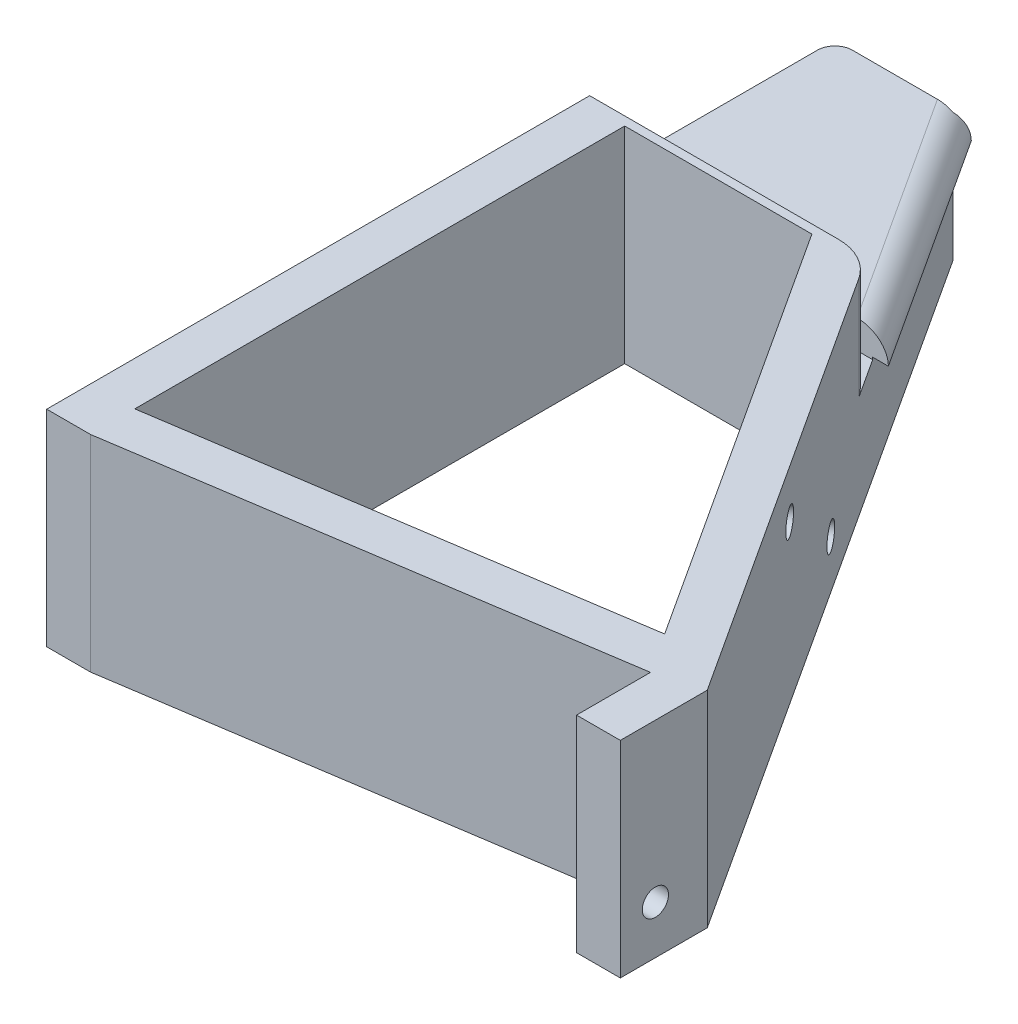
from build123d import *

# Parameters (mm, degrees)
BOSS_EXTRU_1_DEPTH       = 23.5
ESQUISSE10_W             = 28
ESQUISSE10_H             = 8.5
ENL_V_MAT_EXTRU_9_DEPTH  = 114.765108887
ESQUISSE11_W             = 33.386172199
ESQUISSE11_H             = 3
BOSS_EXTRU_2_DEPTH       = 1.5
ESQUISSE12_W             = 1.8
ESQUISSE12_H             = 11.75
ENL_V_MAT_EXTRU_10_DEPTH = 114.765108887
COQUE2_DEPTH             = 23.5
COQUE2_2_DEPTH           = 10.75
COQUE2_START             = 10.75
COQUE2_3_DEPTH           = 3.25
CONG_2_R                 = 2
CONG_3_R                 = 3
ESQUISSE5_R              = 1.5
ENL_V_MAT_EXTRU_4_DEPTH  = 8
ESQUISSE7_R              = 1.5
ENL_V_MAT_EXTRU_6_DEPTH  = 8
ESQUISSE9_R              = 1.5
ENL_V_MAT_EXTRU_8_DEPTH  = 7.5
BOSS_EXTRU_3_DEPTH       = 23.5
BOSS_EXTRU_4_DEPTH       = 10.75
ENL_V_MAT_EXTRU_11_DEPTH = 2.5
ENL_V_MAT_EXTRU_12_DEPTH = 2.5
ENL_V_MAT_EXTRU_13_DEPTH = 2.5
CONG_5_R                 = 6


# Read off the part's stored shape, not the designer's step: Coque2
with BuildPart() as part:
    # Esquisse1 → Boss.-Extru.1 (new body)
    with BuildSketch(Plane(origin=(0, 0, 0), x_dir=(1, 0, 0), z_dir=(0, 1, 0))):
        Polygon((0, 0), (13.5, 0), (65.5, -80.072978118), (65.5, -90), (0, -90), align=None)
    extrude(amount=BOSS_EXTRU_1_DEPTH)

    # Esquisse10 → Enlèv. mat.-Extru.9 (cut, through all)
    with BuildSketch(Plane(origin=(65.5, 0, 0), x_dir=(0, 0, -1), z_dir=(1, 0, 0))):
        with Locations((-14, 19.25)):
            Rectangle(ESQUISSE10_W, ESQUISSE10_H)
    extrude(amount=-ENL_V_MAT_EXTRU_9_DEPTH, mode=Mode.SUBTRACT)

    # Esquisse11 → Boss.-Extru.2 (add)
    with BuildSketch(Plane(origin=(9.495472341, 0, -6.166431839), x_dir=(-0.5446390350150256, 0, -0.838670567945425), z_dir=(0.8386705679454252, 0, -0.5446390350150256))):
        with Locations((-24.045713072, 13.5)):
            Rectangle(ESQUISSE11_W, ESQUISSE11_H)
    extrude(amount=BOSS_EXTRU_2_DEPTH)

    # Esquisse12 → Enlèv. mat.-Extru.10 (cut, through all)
    with BuildSketch(Plane.ZY):
        with Locations((27.1, 17.625)):
            Rectangle(ESQUISSE12_W, ESQUISSE12_H)
    extrude(amount=-ENL_V_MAT_EXTRU_10_DEPTH, mode=Mode.SUBTRACT)

    # Coque2 outline → Coque2 (cut)
    with BuildSketch(Plane(origin=(0, 0, 0), x_dir=(1, 0, 0), z_dir=(0, 1, 0))):
        Polygon((60.5, -81.554045593), (26.371003739, -29), (5, -29), (5, -90), (60.5, -90), align=None)
    extrude(amount=COQUE2_DEPTH, mode=Mode.SUBTRACT)

    # Coque2 2 outline → Coque2 2 (cut)
    with BuildSketch(Plane(origin=(0, 0, 0), x_dir=(1, 0, 0), z_dir=(0, 1, 0))):
        Polygon((10.785221502, -5), (5, -5), (5, -29), (26.371003739, -29), align=None)
    extrude(amount=COQUE2_2_DEPTH, mode=Mode.SUBTRACT)

    # Coque2 3 outline → Coque2 3 (cut)
    with BuildSketch(Plane(origin=(0, 0, 0), x_dir=(1, 0, 0), z_dir=(0, 1, 0)).offset(COQUE2_START)):
        Polygon((23.903254884, -25.2), (10.785221502, -5), (5, -5), (5, -25.2), align=None)
    extrude(amount=COQUE2_3_DEPTH, mode=Mode.SUBTRACT)

    # Congé2
    cong_2_edges = [part.edges().sort_by_distance(p)[0] for p in [
        (0, 7.5, 0),
    ]]
    fillet(cong_2_edges, radius=CONG_2_R)

    # Congé3
    cong_3_edges = [part.edges().sort_by_distance(p)[0] for p in [
        (23.530514866, 15, 12.691520724),
    ]]
    fillet(cong_3_edges, radius=CONG_3_R - 0.0001)  # a hair under: the kernel refuses the full size

    # Esquisse5 → Enlèv. mat.-Extru.4 (cut)
    with BuildSketch(Plane.ZY):
        with Locations((15, 7)):
            Circle(ESQUISSE5_R)
        with Locations((75, 7)):
            Circle(ESQUISSE5_R)
    extrude(amount=-ENL_V_MAT_EXTRU_4_DEPTH, mode=Mode.SUBTRACT)

    # Esquisse7 → Enlèv. mat.-Extru.6 (cut)
    with BuildSketch(Plane(origin=(9.495472341, 0, -6.166431839), x_dir=(-0.5446390350150254, 0, -0.8386705679454252), z_dir=(0.8386705679454252, 0, -0.5446390350150254))):
        with Locations((-54.852626973, 5.5)):
            Circle(ESQUISSE7_R)
        with Locations(Location((-70.828706829, 18, 0), (0, 0, 180))):
            Circle(ESQUISSE7_R)
    extrude(amount=-ENL_V_MAT_EXTRU_6_DEPTH, mode=Mode.SUBTRACT)

    # Esquisse9 → Enlèv. mat.-Extru.8 (cut)
    with BuildSketch(Plane(origin=(65.5, 0, 0), x_dir=(0, 0, -1), z_dir=(1, 0, 0))):
        with Locations((-86, 5.5)):
            Circle(ESQUISSE9_R)
    extrude(amount=-ENL_V_MAT_EXTRU_8_DEPTH, mode=Mode.SUBTRACT)

    # Esquisse13 → Boss.-Extru.3 (add)
    with BuildSketch(Plane.XZ):
        Polygon((60.5, 81.554045593), (5, 90), (5, 84.94243498), (57.510973677, 76.951348682), align=None)
    extrude(amount=-BOSS_EXTRU_3_DEPTH)

    # Esquisse14 → Boss.-Extru.4 (add)
    with BuildSketch(Plane.XZ.offset(-10.75)):
        Polygon((5, 25.2), (23.903254884, 25.2), (26.371003739, 29), (5, 29), align=None)
    extrude(amount=BOSS_EXTRU_4_DEPTH)

    # Esquisse16 → Enlèv. mat.-Extru.11 (cut)
    with BuildSketch(Plane(origin=(5, 0, 0), x_dir=(0, 0, -1), z_dir=(1, 0, 0))):
        Polygon((-72.25, 8.58771324), (-75, 10.175426481), (-77.75, 8.58771324), (-77.75, 5.41228676), (-75, 3.824573519), (-72.25, 5.41228676), align=None)
        Polygon((-12.25, 8.58771324), (-15, 10.175426481), (-17.75, 8.58771324), (-17.75, 5.41228676), (-15, 3.824573519), (-12.25, 5.41228676), align=None)
    extrude(amount=-ENL_V_MAT_EXTRU_11_DEPTH, mode=Mode.SUBTRACT)

    # Esquisse17 → Enlèv. mat.-Extru.12 (cut)
    with BuildSketch(Plane.ZY.offset(-60.5)):
        Polygon((86, 2.324573519), (88.75, 3.91228676), (88.75, 7.08771324), (86, 8.675426481), (83.25, 7.08771324), (83.25, 3.91228676), align=None)
    extrude(amount=-ENL_V_MAT_EXTRU_12_DEPTH, mode=Mode.SUBTRACT)

    # Esquisse18 → Enlèv. mat.-Extru.13 (cut)
    with BuildSketch(Plane(origin=(5.302119501, 0, -3.443236664), x_dir=(0.5446390350150256, 0, 0.838670567945425), z_dir=(-0.8386705679454252, 0, 0.5446390350150256))):
        Polygon((57.602626973, 7.08771324), (54.852626973, 8.675426481), (52.102626973, 7.08771324), (52.102626973, 3.91228676), (54.852626973, 2.324573519), (57.602626973, 3.91228676), align=None)
        Polygon((73.578706829, 19.58771324), (70.828706829, 21.175426481), (68.078706829, 19.58771324), (68.078706829, 16.41228676), (70.828706829, 14.824573519), (73.578706829, 16.41228676), align=None)
    extrude(amount=-ENL_V_MAT_EXTRU_13_DEPTH, mode=Mode.SUBTRACT)

    # Congé5
    cong_5_edges = [part.edges().sort_by_distance(p)[0] for p in [
        (31.68341261, 17.625, 28),
    ]]
    fillet(cong_5_edges, radius=CONG_5_R)


solid = part.part
